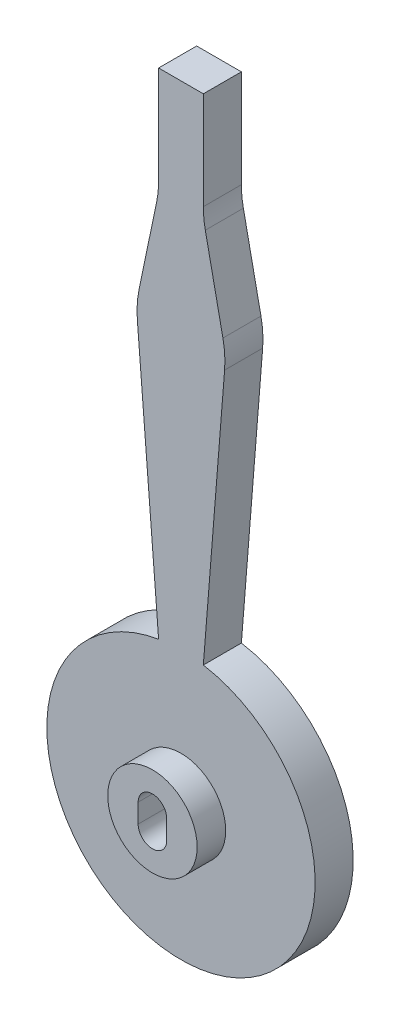
from build123d import *

# Parameters (mm, degrees)
SKETCH1_R           = 4.7
BOSS_EXTRUDE1_DEPTH = 4
SKETCH1_3_R         = 4.7
BOSS_EXTRUDE2_DEPTH = 7
CUT_EXTRUDE1_DEPTH  = 3


with BuildPart() as part:
    # Sketch1 → Boss-Extrude1 (new body)
    with BuildSketch(Plane.XY):
        with BuildLine():
            Line((2.35, 13.90278749), (4.585741176, 41.864603012))
            ThreePointArc((4.585741176, 41.864603012), (4.597967377, 43.28721197), (4.408193437, 44.697159337))
            Line((4.408193437, 44.697159337), (2.559360842, 53.589805153))
            ThreePointArc((2.559360842, 53.589805153), (2.402477907, 54.602201264), (2.35, 55.625335767))
            Line((2.35, 55.625335767), (2.35, 65.9))
            Line((2.35, 65.9), (-2.35, 65.9))
            Line((-2.35, 65.9), (-2.35, 55.625335767))
            ThreePointArc((-2.35, 55.625335767), (-2.402477907, 54.602201264), (-2.559360842, 53.589805153))
            Line((-2.559360842, 53.589805153), (-4.408193437, 44.697159337))
            ThreePointArc((-4.408193437, 44.697159337), (-4.597967377, 43.28721197), (-4.585741176, 41.864603012))
            Line((-4.585741176, 41.864603012), (-2.35, 13.90278749))
            ThreePointArc((-2.35, 13.90278749), (0, -14.1), (2.35, 13.90278749))
        make_face()
        Circle(SKETCH1_R, mode=Mode.SUBTRACT)
    extrude(amount=BOSS_EXTRUDE1_DEPTH)

    # Sketch1<3> → Boss-Extrude2 (add)
    with BuildSketch(Plane.XY):
        Circle(SKETCH1_3_R)
    extrude(amount=BOSS_EXTRUDE2_DEPTH)

    # Sketch2 → Cut-Extrude1 (cut)
    with BuildSketch(Plane.XY.offset(7)):
        with BuildLine():
            Line((1.5, 1), (1.5, -1))
            ThreePointArc((1.5, -1), (0, -2.5), (-1.5, -1))
            Line((-1.5, -1), (-1.5, 1))
            ThreePointArc((-1.5, 1), (0, 2.5), (1.5, 1))
        make_face()
    extrude(amount=-CUT_EXTRUDE1_DEPTH, mode=Mode.SUBTRACT)


solid = part.part
